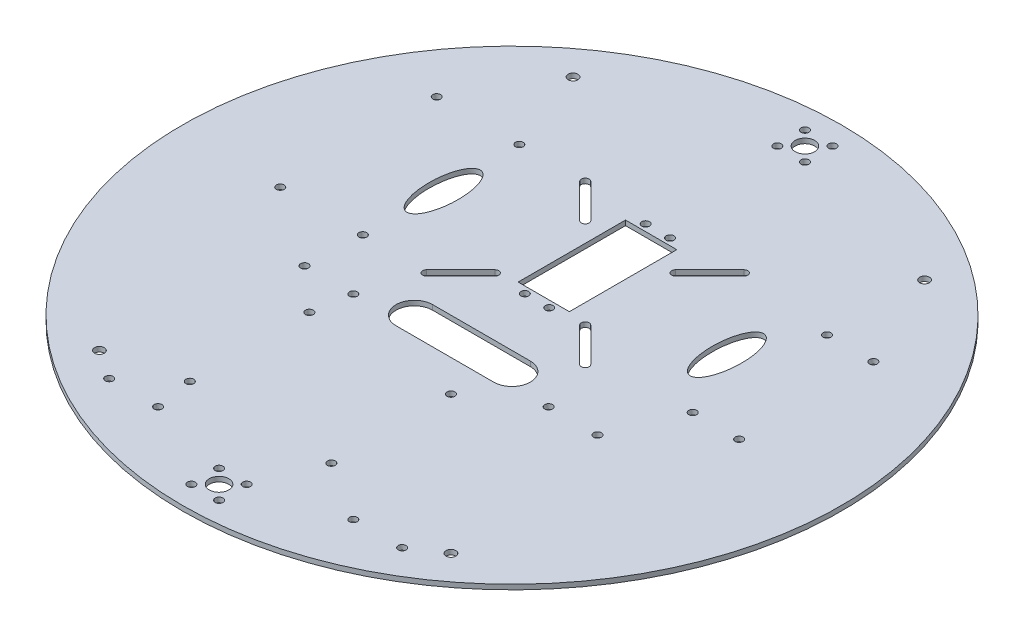
from build123d import *

# Parameters (mm, degrees)
SKETCH_1_R          = 135
EXTRUDE_1_DEPTH     = 2
SKETCH_562_R        = 1.6
SKETCH_562_W        = 21
SKETCH_562_H        = 44
CUT_EXTRUDE_1_DEPTH = 10
SKETCH_1031_R       = 1.6
CUT_EXTRUDE_2_DEPTH = 10
SKETCH_4_R          = 2
SKETCH_4_R_2        = 4
SKETCH_4_R_3        = 1.6
CUT_EXTRUDE_3_DEPTH = 10
CUT_EXTRUDE_4_DEPTH = 10
SKETCH_6_R          = 1.6
SKETCH_6_RX         = 15
SKETCH_6_RY         = 6
CUT_EXTRUDE_7_DEPTH = 10


with BuildPart() as part:
    # 草图1 → 凸台-拉伸1 (new body)
    with BuildSketch(Plane(origin=(0, 0, 0), x_dir=(1, 0, 0), z_dir=(0, 1, 0))):
        Circle(SKETCH_1_R)
    extrude(amount=EXTRUDE_1_DEPTH)

    # Sketch 562 → 切除-拉伸1 (cut)
    with BuildSketch(Plane(origin=(0, 2, 0), x_dir=(1, 0, 0), z_dir=(0, 1, 0))):
        with Locations((-5, 59.75)):
            Circle(SKETCH_562_R)
        with Locations((5, 59.75)):
            Circle(SKETCH_562_R)
        with Locations((-5, 10.25)):
            Circle(SKETCH_562_R)
        with Locations((5, 10.25)):
            Circle(SKETCH_562_R)
        with Locations((18.5, 48.5)):
            Circle(SKETCH_562_R)
        with Locations((18.5, 11.5)):
            Circle(SKETCH_562_R)
        with Locations((-18.5, 11.5)):
            Circle(SKETCH_562_R)
        with Locations((-18.5, 48.5)):
            Circle(SKETCH_562_R)
        with Locations((0, 35)):
            Rectangle(SKETCH_562_W, SKETCH_562_H)
    extrude(amount=-CUT_EXTRUDE_1_DEPTH, mode=Mode.SUBTRACT)

    # Sketch 1031 → 切除-拉伸2 (cut)
    with BuildSketch(Plane(origin=(0, 2, 0), x_dir=(1, 0, 0), z_dir=(0, 1, 0))):
        with Locations((-60, -25)):
            Circle(SKETCH_1031_R)
        with Locations((-40, -25)):
            Circle(SKETCH_1031_R)
        with Locations((40, -25)):
            Circle(SKETCH_1031_R)
        with Locations((60, -25)):
            Circle(SKETCH_1031_R)
        with Locations((60, -105)):
            Circle(SKETCH_1031_R)
        with Locations((40, -105)):
            Circle(SKETCH_1031_R)
        with Locations((-40, -105)):
            Circle(SKETCH_1031_R)
        with Locations((-60, -105)):
            Circle(SKETCH_1031_R)
        with Locations((-42.5, -89.5)):
            Circle(SKETCH_1031_R)
        with Locations((-42.5, -40.5)):
            Circle(SKETCH_1031_R)
        with Locations((15.5, -40.5)):
            Circle(SKETCH_1031_R)
        with Locations((15.5, -89.5)):
            Circle(SKETCH_1031_R)
    extrude(amount=-CUT_EXTRUDE_2_DEPTH, mode=Mode.SUBTRACT)

    # 草图4 → 切除-拉伸3 (cut)
    with BuildSketch(Plane(origin=(0, 2, 0), x_dir=(1, 0, 0), z_dir=(0, 1, 0))):
        with Locations((-72, 97)):
            Circle(SKETCH_4_R)
        with Locations((72, 97)):
            Circle(SKETCH_4_R)
        with Locations((72, -97)):
            Circle(SKETCH_4_R)
        with Locations((-72, -97)):
            Circle(SKETCH_4_R)
        with Locations((0, -120)):
            Circle(SKETCH_4_R_2)
        with Locations((-5.656854249, -125.656854249)):
            Circle(SKETCH_4_R_3)
        with Locations((-5.656854249, -114.343145751)):
            Circle(SKETCH_4_R_3)
        with Locations((5.656854249, -114.343145751)):
            Circle(SKETCH_4_R_3)
        with Locations((5.656854249, -125.656854249)):
            Circle(SKETCH_4_R_3)
        with Locations((5.656854249, 125.656854249)):
            Circle(SKETCH_4_R_3)
        with Locations((5.656854249, 114.343145751)):
            Circle(SKETCH_4_R_3)
        with Locations((-5.656854249, 114.343145751)):
            Circle(SKETCH_4_R_3)
        with Locations((-5.656854249, 125.656854249)):
            Circle(SKETCH_4_R_3)
        with Locations((0, 120)):
            Circle(SKETCH_4_R_2)
        with BuildLine():
            Line((-20, -12.5), (20, -12.5))
            ThreePointArc((20, -12.5), (27.5, -20), (20, -27.5))
            Line((20, -27.5), (-20, -27.5))
            ThreePointArc((-20, -27.5), (-27.5, -20), (-20, -12.5))
        make_face()
    extrude(amount=-CUT_EXTRUDE_3_DEPTH, mode=Mode.SUBTRACT)

    # 草图5 → 切除-拉伸4 (cut)
    with BuildSketch(Plane(origin=(0, 2, 0), x_dir=(1, 0, 0), z_dir=(0, 1, 0))):
        with BuildLine():
            Line((-31.36862915, 63.63137085), (-17.36862915, 49.63137085))
            ThreePointArc((-17.36862915, 49.63137085), (-17.36862915, 47.36862915), (-19.63137085, 47.36862915))
            Line((-19.63137085, 47.36862915), (-33.63137085, 61.36862915))
            ThreePointArc((-33.63137085, 61.36862915), (-33.63137085, 63.63137085), (-31.36862915, 63.63137085))
        make_face()
        with BuildLine():
            Line((33.63137085, 61.36862915), (19.63137085, 47.36862915))
            ThreePointArc((19.63137085, 47.36862915), (17.36862915, 47.36862915), (17.36862915, 49.63137085))
            Line((17.36862915, 49.63137085), (31.36862915, 63.63137085))
            ThreePointArc((31.36862915, 63.63137085), (33.63137085, 63.63137085), (33.63137085, 61.36862915))
        make_face()
        with BuildLine():
            Line((31.36862915, -3.63137085), (17.36862915, 10.36862915))
            ThreePointArc((17.36862915, 10.36862915), (17.36862915, 12.63137085), (19.63137085, 12.63137085))
            Line((19.63137085, 12.63137085), (33.63137085, -1.36862915))
            ThreePointArc((33.63137085, -1.36862915), (33.63137085, -3.63137085), (31.36862915, -3.63137085))
        make_face()
        with BuildLine():
            Line((-33.63137085, -1.36862915), (-19.63137085, 12.63137085))
            ThreePointArc((-19.63137085, 12.63137085), (-17.36862915, 12.63137085), (-17.36862915, 10.36862915))
            Line((-17.36862915, 10.36862915), (-31.36862915, -3.63137085))
            ThreePointArc((-31.36862915, -3.63137085), (-33.63137085, -3.63137085), (-33.63137085, -1.36862915))
        make_face()
    extrude(amount=-CUT_EXTRUDE_4_DEPTH, mode=Mode.SUBTRACT)

    # 草图6 → 切除-拉伸7 (cut)
    with BuildSketch(Plane(origin=(0, 2, 0), x_dir=(1, 0, 0), z_dir=(0, 1, 0))):
        with Locations((71.537199543, 2.5)):
            Circle(SKETCH_6_R)
        with Locations((90.537199543, 2.5)):
            Circle(SKETCH_6_R)
        with Locations((90.537199543, 57.5)):
            Circle(SKETCH_6_R)
        with Locations((71.537199543, 57.5)):
            Circle(SKETCH_6_R)
        with Locations((-92.885957975, -2.05)):
            Circle(SKETCH_6_R)
        with Locations((-59.045957975, -2.05)):
            Circle(SKETCH_6_R)
        with Locations((-92.885957975, 62.05)):
            Circle(SKETCH_6_R)
        with Locations((-59.045957975, 62.05)):
            Circle(SKETCH_6_R)
        with Locations(Location((-58.031053316, 30), (0, 0, -90))):
            Ellipse(SKETCH_6_RX, SKETCH_6_RY)
        with Locations(Location((58.031053316, 30), (0, 0, 90))):
            Ellipse(SKETCH_6_RX, SKETCH_6_RY)
    extrude(amount=-CUT_EXTRUDE_7_DEPTH, mode=Mode.SUBTRACT)


solid = part.part
